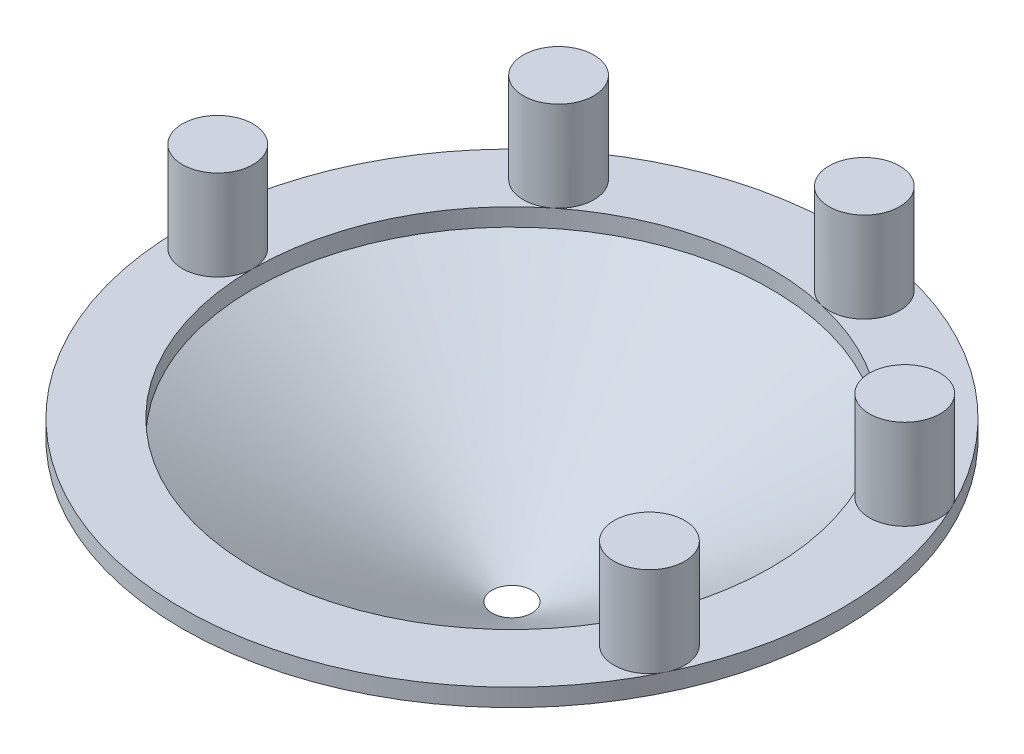
from build123d import *

# Parameters (mm, degrees)
SKETCH3_R           = 3
BOSS_EXTRUDE1_DEPTH = 9.155
CIRPATTERN1_COUNT   = 5
CIRPATTERN1_ANGLE   = 205.714285714


with BuildPart() as part:
    # Sketch1 → Revolve1 (revolve)
    with BuildSketch(Plane.XY):
        Polygon((28, 0), (3.175, -12), (1.68595, -12), (22, 0), (22, 1.5), (28, 1.5), align=None)
    revolve(axis=Axis((0, -582.446756226, 0), (0, 1, 0)))

    # Sketch3 → Boss-Extrude1 (add)
    with BuildSketch(Plane(origin=(0, 0, 0), x_dir=(1, 0, 0), z_dir=(0, 1, 0))):
        with Locations((-25, 0)):
            Circle(SKETCH3_R)
    boss_extrude1 = extrude(amount=BOSS_EXTRUDE1_DEPTH)

    # CirPattern1: Boss-Extrude1 ×5 about axis
    cirpattern1_axis = Axis((0, 0, 0), (0, -1, 0))
    for i in range(1, CIRPATTERN1_COUNT):
        add(boss_extrude1.rotate(cirpattern1_axis, i * CIRPATTERN1_ANGLE / (CIRPATTERN1_COUNT - 1)))


solid = part.part
